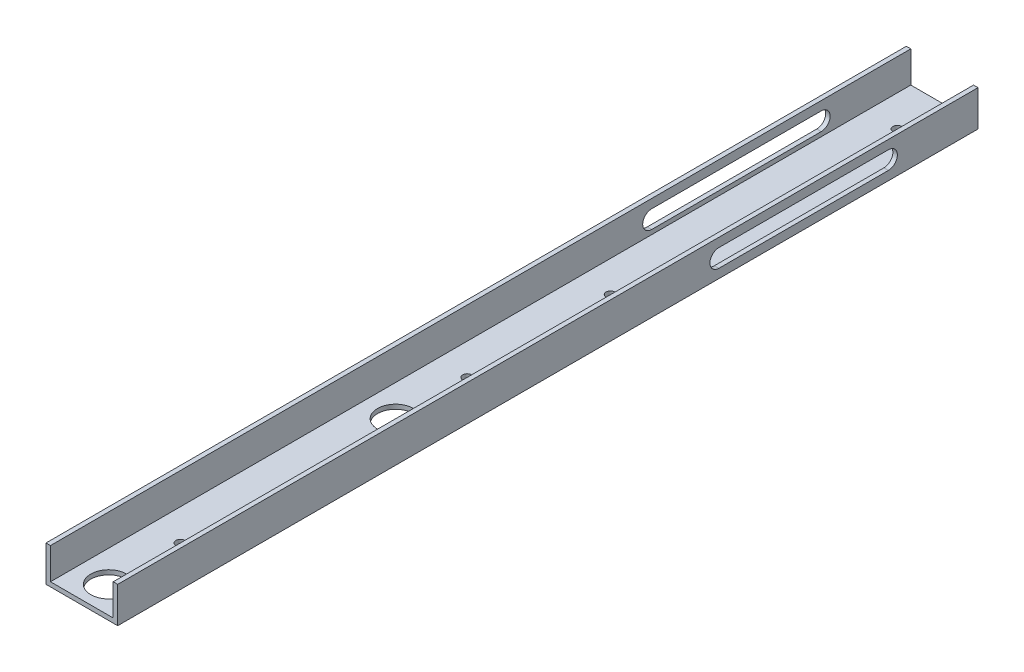
from build123d import *

# Parameters (mm, degrees)
BOSS_EXTRUDE1_DEPTH = 609.6
CUT_EXTRUDE1_REACH  = 614.117
SKETCH2_R           = 12.7
SKETCH2_R_2         = 3.175
CUT_EXTRUDE2_REACH  = 614.117
SKETCH3_R           = 3.175
CUT_EXTRUDE3_DEPTH  = 613.240116294


with BuildPart() as part:
    # Sketch1 → Boss-Extrude1 (new body)
    with BuildSketch(Plane.XY):
        Polygon((47.625, 3.175), (47.625, 25.4), (50.8, 25.4), (50.8, 0), (0, 0), (0, 25.4), (3.175, 25.4), (3.175, 3.175), align=None)
    extrude(amount=BOSS_EXTRUDE1_DEPTH)

    # Sketch2 → Cut-Extrude1 (cut, up to next)
    with BuildSketch(Plane(origin=(0, 3.175, 0), x_dir=(1, 0, 0), z_dir=(0, 1, 0)), mode=Mode.PRIVATE) as cut_extrude1_sk1:
        with Locations((25.4, -590.55)):
            Circle(SKETCH2_R)
    cut_extrude1_tool1 = extrude(cut_extrude1_sk1.sketch, amount=-CUT_EXTRUDE1_REACH, mode=Mode.PRIVATE) & part.part
    # Sketch2 → Cut-Extrude1 (cut, up to next)
    with BuildSketch(Plane(origin=(0, 3.175, 0), x_dir=(1, 0, 0), z_dir=(0, 1, 0)), mode=Mode.PRIVATE) as cut_extrude1_sk2:
        with Locations((25.4, -387.35)):
            Circle(SKETCH2_R)
    cut_extrude1_tool2 = extrude(cut_extrude1_sk2.sketch, amount=-CUT_EXTRUDE1_REACH, mode=Mode.PRIVATE) & part.part
    # Sketch2 → Cut-Extrude1 (cut, up to next)
    with BuildSketch(Plane(origin=(0, 3.175, 0), x_dir=(1, 0, 0), z_dir=(0, 1, 0)), mode=Mode.PRIVATE) as cut_extrude1_sk3:
        with Locations((25.4, -539.75)):
            Circle(SKETCH2_R_2)
    cut_extrude1_tool3 = extrude(cut_extrude1_sk3.sketch, amount=-CUT_EXTRUDE1_REACH, mode=Mode.PRIVATE) & part.part
    # Sketch2 → Cut-Extrude1 (cut, up to next)
    with BuildSketch(Plane(origin=(0, 3.175, 0), x_dir=(1, 0, 0), z_dir=(0, 1, 0)), mode=Mode.PRIVATE) as cut_extrude1_sk4:
        with Locations((25.4, -336.55)):
            Circle(SKETCH2_R_2)
    cut_extrude1_tool4 = extrude(cut_extrude1_sk4.sketch, amount=-CUT_EXTRUDE1_REACH, mode=Mode.PRIVATE) & part.part
    add(cut_extrude1_tool1.solids().sort_by_distance((25.4, 3.175, 590.55))[0], mode=Mode.SUBTRACT)
    add(cut_extrude1_tool2.solids().sort_by_distance((25.4, 3.175, 387.35))[0], mode=Mode.SUBTRACT)
    add(cut_extrude1_tool3.solids().sort_by_distance((25.4, 3.175, 539.75))[0], mode=Mode.SUBTRACT)
    add(cut_extrude1_tool4.solids().sort_by_distance((25.4, 3.175, 336.55))[0], mode=Mode.SUBTRACT)

    # Sketch3 → Cut-Extrude2 (cut, up to next)
    with BuildSketch(Plane(origin=(0, 3.175, 0), x_dir=(1, 0, 0), z_dir=(0, 1, 0)), mode=Mode.PRIVATE) as cut_extrude2_sk1:
        with Locations((25.4, -234.95)):
            Circle(SKETCH3_R)
    cut_extrude2_tool1 = extrude(cut_extrude2_sk1.sketch, amount=-CUT_EXTRUDE2_REACH, mode=Mode.PRIVATE) & part.part
    # Sketch3 → Cut-Extrude2 (cut, up to next)
    with BuildSketch(Plane(origin=(0, 3.175, 0), x_dir=(1, 0, 0), z_dir=(0, 1, 0)), mode=Mode.PRIVATE) as cut_extrude2_sk2:
        with Locations((25.4, -31.75)):
            Circle(SKETCH3_R)
    cut_extrude2_tool2 = extrude(cut_extrude2_sk2.sketch, amount=-CUT_EXTRUDE2_REACH, mode=Mode.PRIVATE) & part.part
    add(cut_extrude2_tool1.solids().sort_by_distance((25.4, 3.175, 234.95))[0], mode=Mode.SUBTRACT)
    add(cut_extrude2_tool2.solids().sort_by_distance((25.4, 3.175, 31.75))[0], mode=Mode.SUBTRACT)

    # Sketch4 → Cut-Extrude3 (cut, through all)
    with BuildSketch(Plane(origin=(50.8, 0, 0), x_dir=(0, 0, -1), z_dir=(1, 0, 0))):
        with BuildLine():
            Line((-183.606708986, 19.05), (-63.5, 19.05))
            ThreePointArc((-63.5, 19.05), (-57.15, 12.7), (-63.5, 6.35))
            Line((-63.5, 6.35), (-183.606708986, 6.35))
            ThreePointArc((-183.606708986, 6.35), (-189.956708986, 12.7), (-183.606708986, 19.05))
        make_face()
    extrude(amount=-CUT_EXTRUDE3_DEPTH, mode=Mode.SUBTRACT)


solid = part.part
